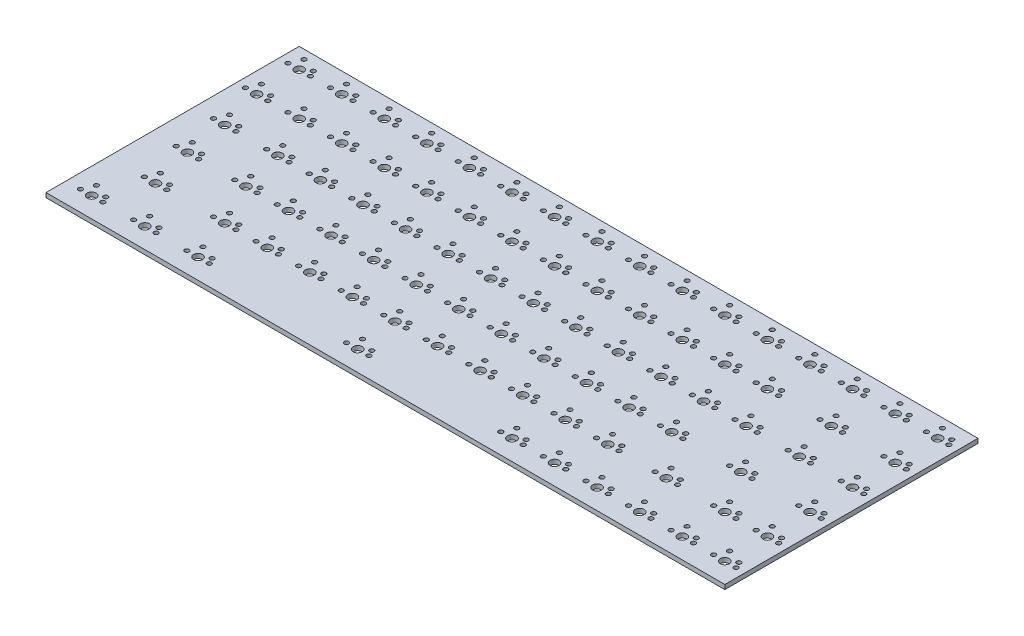
from build123d import *

# Parameters (mm, degrees)
SKETCH_1_W      = 303
SKETCH_1_H      = 113
SKETCH_1_R      = 1
SKETCH_1_R_2    = 2
EXTRUDE_1_DEPTH = 2


with BuildPart() as part:
    # Эскиз1 → Бобышка-Вытянуть1 (new body)
    with BuildSketch(Plane(origin=(0, 0, 0), x_dir=(1, 0, 0), z_dir=(0, 1, 0))):
        with Locations((142.5, -47.5)):
            Rectangle(SKETCH_1_W, SKETCH_1_H)
        with Locations((-2.867586508, 5)):
            Circle(SKETCH_1_R, mode=Mode.SUBTRACT)
        Circle(SKETCH_1_R_2, mode=Mode.SUBTRACT)
        with Locations((-5, 0)):
            Circle(SKETCH_1_R, mode=Mode.SUBTRACT)
        with Locations((5, 0)):
            Circle(SKETCH_1_R, mode=Mode.SUBTRACT)
        with Locations((3.65, 2.6)):
            Circle(SKETCH_1_R, mode=Mode.SUBTRACT)
        with Locations((16.132413492, 5)):
            Circle(SKETCH_1_R, mode=Mode.SUBTRACT)
        with Locations((19, 0)):
            Circle(SKETCH_1_R_2, mode=Mode.SUBTRACT)
        with Locations((14, 0)):
            Circle(SKETCH_1_R, mode=Mode.SUBTRACT)
        with Locations((24, 0)):
            Circle(SKETCH_1_R, mode=Mode.SUBTRACT)
        with Locations((22.65, 2.6)):
            Circle(SKETCH_1_R, mode=Mode.SUBTRACT)
        with Locations((16.132413492, -14)):
            Circle(SKETCH_1_R, mode=Mode.SUBTRACT)
        with Locations((19, -19)):
            Circle(SKETCH_1_R_2, mode=Mode.SUBTRACT)
        with Locations((14, -19)):
            Circle(SKETCH_1_R, mode=Mode.SUBTRACT)
        with Locations((24, -19)):
            Circle(SKETCH_1_R, mode=Mode.SUBTRACT)
        with Locations((22.65, -16.4)):
            Circle(SKETCH_1_R, mode=Mode.SUBTRACT)
        with Locations((-2.867586508, -14)):
            Circle(SKETCH_1_R, mode=Mode.SUBTRACT)
        with Locations((0, -19)):
            Circle(SKETCH_1_R_2, mode=Mode.SUBTRACT)
        with Locations((-5, -19)):
            Circle(SKETCH_1_R, mode=Mode.SUBTRACT)
        with Locations((5, -19)):
            Circle(SKETCH_1_R, mode=Mode.SUBTRACT)
        with Locations((3.65, -16.4)):
            Circle(SKETCH_1_R, mode=Mode.SUBTRACT)
        with Locations((35.132413492, 5)):
            Circle(SKETCH_1_R, mode=Mode.SUBTRACT)
        with Locations((38, 0)):
            Circle(SKETCH_1_R_2, mode=Mode.SUBTRACT)
        with Locations((33, 0)):
            Circle(SKETCH_1_R, mode=Mode.SUBTRACT)
        with Locations((43, 0)):
            Circle(SKETCH_1_R, mode=Mode.SUBTRACT)
        with Locations((41.65, 2.6)):
            Circle(SKETCH_1_R, mode=Mode.SUBTRACT)
        with Locations((35.132413492, -14)):
            Circle(SKETCH_1_R, mode=Mode.SUBTRACT)
        with Locations((38, -19)):
            Circle(SKETCH_1_R_2, mode=Mode.SUBTRACT)
        with Locations((33, -19)):
            Circle(SKETCH_1_R, mode=Mode.SUBTRACT)
        with Locations((43, -19)):
            Circle(SKETCH_1_R, mode=Mode.SUBTRACT)
        with Locations((41.65, -16.4)):
            Circle(SKETCH_1_R, mode=Mode.SUBTRACT)
        with Locations((54.132413492, 5)):
            Circle(SKETCH_1_R, mode=Mode.SUBTRACT)
        with Locations((57, 0)):
            Circle(SKETCH_1_R_2, mode=Mode.SUBTRACT)
        with Locations((52, 0)):
            Circle(SKETCH_1_R, mode=Mode.SUBTRACT)
        with Locations((62, 0)):
            Circle(SKETCH_1_R, mode=Mode.SUBTRACT)
        with Locations((60.65, 2.6)):
            Circle(SKETCH_1_R, mode=Mode.SUBTRACT)
        with Locations((54.132413492, -14)):
            Circle(SKETCH_1_R, mode=Mode.SUBTRACT)
        with Locations((57, -19)):
            Circle(SKETCH_1_R_2, mode=Mode.SUBTRACT)
        with Locations((52, -19)):
            Circle(SKETCH_1_R, mode=Mode.SUBTRACT)
        with Locations((62, -19)):
            Circle(SKETCH_1_R, mode=Mode.SUBTRACT)
        with Locations((60.65, -16.4)):
            Circle(SKETCH_1_R, mode=Mode.SUBTRACT)
        with Locations((73.132413492, 5)):
            Circle(SKETCH_1_R, mode=Mode.SUBTRACT)
        with Locations((76, 0)):
            Circle(SKETCH_1_R_2, mode=Mode.SUBTRACT)
        with Locations((71, 0)):
            Circle(SKETCH_1_R, mode=Mode.SUBTRACT)
        with Locations((81, 0)):
            Circle(SKETCH_1_R, mode=Mode.SUBTRACT)
        with Locations((79.65, 2.6)):
            Circle(SKETCH_1_R, mode=Mode.SUBTRACT)
        with Locations((92.132413492, 5)):
            Circle(SKETCH_1_R, mode=Mode.SUBTRACT)
        with Locations((95, 0)):
            Circle(SKETCH_1_R_2, mode=Mode.SUBTRACT)
        with Locations((90, 0)):
            Circle(SKETCH_1_R, mode=Mode.SUBTRACT)
        with Locations((100, 0)):
            Circle(SKETCH_1_R, mode=Mode.SUBTRACT)
        with Locations((98.65, 2.6)):
            Circle(SKETCH_1_R, mode=Mode.SUBTRACT)
        with Locations((111.132413492, 5)):
            Circle(SKETCH_1_R, mode=Mode.SUBTRACT)
        with Locations((114, 0)):
            Circle(SKETCH_1_R_2, mode=Mode.SUBTRACT)
        with Locations((109, 0)):
            Circle(SKETCH_1_R, mode=Mode.SUBTRACT)
        with Locations((119, 0)):
            Circle(SKETCH_1_R, mode=Mode.SUBTRACT)
        with Locations((117.65, 2.6)):
            Circle(SKETCH_1_R, mode=Mode.SUBTRACT)
        with Locations((130.132413492, 5)):
            Circle(SKETCH_1_R, mode=Mode.SUBTRACT)
        with Locations((133, 0)):
            Circle(SKETCH_1_R_2, mode=Mode.SUBTRACT)
        with Locations((128, 0)):
            Circle(SKETCH_1_R, mode=Mode.SUBTRACT)
        with Locations((138, 0)):
            Circle(SKETCH_1_R, mode=Mode.SUBTRACT)
        with Locations((136.65, 2.6)):
            Circle(SKETCH_1_R, mode=Mode.SUBTRACT)
        with Locations((149.132413492, 5)):
            Circle(SKETCH_1_R, mode=Mode.SUBTRACT)
        with Locations((152, 0)):
            Circle(SKETCH_1_R_2, mode=Mode.SUBTRACT)
        with Locations((147, 0)):
            Circle(SKETCH_1_R, mode=Mode.SUBTRACT)
        with Locations((157, 0)):
            Circle(SKETCH_1_R, mode=Mode.SUBTRACT)
        with Locations((155.65, 2.6)):
            Circle(SKETCH_1_R, mode=Mode.SUBTRACT)
        with Locations((168.132413492, 5)):
            Circle(SKETCH_1_R, mode=Mode.SUBTRACT)
        with Locations((171, 0)):
            Circle(SKETCH_1_R_2, mode=Mode.SUBTRACT)
        with Locations((166, 0)):
            Circle(SKETCH_1_R, mode=Mode.SUBTRACT)
        with Locations((176, 0)):
            Circle(SKETCH_1_R, mode=Mode.SUBTRACT)
        with Locations((174.65, 2.6)):
            Circle(SKETCH_1_R, mode=Mode.SUBTRACT)
        with Locations((187.132413492, 5)):
            Circle(SKETCH_1_R, mode=Mode.SUBTRACT)
        with Locations((190, 0)):
            Circle(SKETCH_1_R_2, mode=Mode.SUBTRACT)
        with Locations((185, 0)):
            Circle(SKETCH_1_R, mode=Mode.SUBTRACT)
        with Locations((195, 0)):
            Circle(SKETCH_1_R, mode=Mode.SUBTRACT)
        with Locations((193.65, 2.6)):
            Circle(SKETCH_1_R, mode=Mode.SUBTRACT)
        with Locations((187.132413492, -14)):
            Circle(SKETCH_1_R, mode=Mode.SUBTRACT)
        with Locations((190, -19)):
            Circle(SKETCH_1_R_2, mode=Mode.SUBTRACT)
        with Locations((185, -19)):
            Circle(SKETCH_1_R, mode=Mode.SUBTRACT)
        with Locations((195, -19)):
            Circle(SKETCH_1_R, mode=Mode.SUBTRACT)
        with Locations((193.65, -16.4)):
            Circle(SKETCH_1_R, mode=Mode.SUBTRACT)
        with Locations((168.132413492, -14)):
            Circle(SKETCH_1_R, mode=Mode.SUBTRACT)
        with Locations((171, -19)):
            Circle(SKETCH_1_R_2, mode=Mode.SUBTRACT)
        with Locations((166, -19)):
            Circle(SKETCH_1_R, mode=Mode.SUBTRACT)
        with Locations((176, -19)):
            Circle(SKETCH_1_R, mode=Mode.SUBTRACT)
        with Locations((174.65, -16.4)):
            Circle(SKETCH_1_R, mode=Mode.SUBTRACT)
        with Locations((149.132413492, -14)):
            Circle(SKETCH_1_R, mode=Mode.SUBTRACT)
        with Locations((152, -19)):
            Circle(SKETCH_1_R_2, mode=Mode.SUBTRACT)
        with Locations((147, -19)):
            Circle(SKETCH_1_R, mode=Mode.SUBTRACT)
        with Locations((157, -19)):
            Circle(SKETCH_1_R, mode=Mode.SUBTRACT)
        with Locations((155.65, -16.4)):
            Circle(SKETCH_1_R, mode=Mode.SUBTRACT)
        with Locations((130.132413492, -14)):
            Circle(SKETCH_1_R, mode=Mode.SUBTRACT)
        with Locations((133, -19)):
            Circle(SKETCH_1_R_2, mode=Mode.SUBTRACT)
        with Locations((128, -19)):
            Circle(SKETCH_1_R, mode=Mode.SUBTRACT)
        with Locations((138, -19)):
            Circle(SKETCH_1_R, mode=Mode.SUBTRACT)
        with Locations((136.65, -16.4)):
            Circle(SKETCH_1_R, mode=Mode.SUBTRACT)
        with Locations((111.132413492, -14)):
            Circle(SKETCH_1_R, mode=Mode.SUBTRACT)
        with Locations((114, -19)):
            Circle(SKETCH_1_R_2, mode=Mode.SUBTRACT)
        with Locations((109, -19)):
            Circle(SKETCH_1_R, mode=Mode.SUBTRACT)
        with Locations((119, -19)):
            Circle(SKETCH_1_R, mode=Mode.SUBTRACT)
        with Locations((117.65, -16.4)):
            Circle(SKETCH_1_R, mode=Mode.SUBTRACT)
        with Locations((92.132413492, -14)):
            Circle(SKETCH_1_R, mode=Mode.SUBTRACT)
        with Locations((95, -19)):
            Circle(SKETCH_1_R_2, mode=Mode.SUBTRACT)
        with Locations((90, -19)):
            Circle(SKETCH_1_R, mode=Mode.SUBTRACT)
        with Locations((100, -19)):
            Circle(SKETCH_1_R, mode=Mode.SUBTRACT)
        with Locations((98.65, -16.4)):
            Circle(SKETCH_1_R, mode=Mode.SUBTRACT)
        with Locations((73.132413492, -14)):
            Circle(SKETCH_1_R, mode=Mode.SUBTRACT)
        with Locations((76, -19)):
            Circle(SKETCH_1_R_2, mode=Mode.SUBTRACT)
        with Locations((71, -19)):
            Circle(SKETCH_1_R, mode=Mode.SUBTRACT)
        with Locations((81, -19)):
            Circle(SKETCH_1_R, mode=Mode.SUBTRACT)
        with Locations((79.65, -16.4)):
            Circle(SKETCH_1_R, mode=Mode.SUBTRACT)
        with Locations((196.632413492, -33)):
            Circle(SKETCH_1_R, mode=Mode.SUBTRACT)
        with Locations((199.5, -38)):
            Circle(SKETCH_1_R_2, mode=Mode.SUBTRACT)
        with Locations((194.5, -38)):
            Circle(SKETCH_1_R, mode=Mode.SUBTRACT)
        with Locations((204.5, -38)):
            Circle(SKETCH_1_R, mode=Mode.SUBTRACT)
        with Locations((203.15, -35.4)):
            Circle(SKETCH_1_R, mode=Mode.SUBTRACT)
        with Locations((177.632413492, -33)):
            Circle(SKETCH_1_R, mode=Mode.SUBTRACT)
        with Locations((180.5, -38)):
            Circle(SKETCH_1_R_2, mode=Mode.SUBTRACT)
        with Locations((175.5, -38)):
            Circle(SKETCH_1_R, mode=Mode.SUBTRACT)
        with Locations((185.5, -38)):
            Circle(SKETCH_1_R, mode=Mode.SUBTRACT)
        with Locations((184.15, -35.4)):
            Circle(SKETCH_1_R, mode=Mode.SUBTRACT)
        with Locations((158.632413492, -33)):
            Circle(SKETCH_1_R, mode=Mode.SUBTRACT)
        with Locations((161.5, -38)):
            Circle(SKETCH_1_R_2, mode=Mode.SUBTRACT)
        with Locations((156.5, -38)):
            Circle(SKETCH_1_R, mode=Mode.SUBTRACT)
        with Locations((166.5, -38)):
            Circle(SKETCH_1_R, mode=Mode.SUBTRACT)
        with Locations((165.15, -35.4)):
            Circle(SKETCH_1_R, mode=Mode.SUBTRACT)
        with Locations((139.632413492, -33)):
            Circle(SKETCH_1_R, mode=Mode.SUBTRACT)
        with Locations((142.5, -38)):
            Circle(SKETCH_1_R_2, mode=Mode.SUBTRACT)
        with Locations((137.5, -38)):
            Circle(SKETCH_1_R, mode=Mode.SUBTRACT)
        with Locations((147.5, -38)):
            Circle(SKETCH_1_R, mode=Mode.SUBTRACT)
        with Locations((146.15, -35.4)):
            Circle(SKETCH_1_R, mode=Mode.SUBTRACT)
        with Locations((120.632413492, -33)):
            Circle(SKETCH_1_R, mode=Mode.SUBTRACT)
        with Locations((123.5, -38)):
            Circle(SKETCH_1_R_2, mode=Mode.SUBTRACT)
        with Locations((118.5, -38)):
            Circle(SKETCH_1_R, mode=Mode.SUBTRACT)
        with Locations((128.5, -38)):
            Circle(SKETCH_1_R, mode=Mode.SUBTRACT)
        with Locations((127.15, -35.4)):
            Circle(SKETCH_1_R, mode=Mode.SUBTRACT)
        with Locations((101.632413492, -33)):
            Circle(SKETCH_1_R, mode=Mode.SUBTRACT)
        with Locations((104.5, -38)):
            Circle(SKETCH_1_R_2, mode=Mode.SUBTRACT)
        with Locations((99.5, -38)):
            Circle(SKETCH_1_R, mode=Mode.SUBTRACT)
        with Locations((109.5, -38)):
            Circle(SKETCH_1_R, mode=Mode.SUBTRACT)
        with Locations((108.15, -35.4)):
            Circle(SKETCH_1_R, mode=Mode.SUBTRACT)
        with Locations((82.632413492, -33)):
            Circle(SKETCH_1_R, mode=Mode.SUBTRACT)
        with Locations((85.5, -38)):
            Circle(SKETCH_1_R_2, mode=Mode.SUBTRACT)
        with Locations((80.5, -38)):
            Circle(SKETCH_1_R, mode=Mode.SUBTRACT)
        with Locations((90.5, -38)):
            Circle(SKETCH_1_R, mode=Mode.SUBTRACT)
        with Locations((89.15, -35.4)):
            Circle(SKETCH_1_R, mode=Mode.SUBTRACT)
        with Locations((63.632413492, -33)):
            Circle(SKETCH_1_R, mode=Mode.SUBTRACT)
        with Locations((66.5, -38)):
            Circle(SKETCH_1_R_2, mode=Mode.SUBTRACT)
        with Locations((61.5, -38)):
            Circle(SKETCH_1_R, mode=Mode.SUBTRACT)
        with Locations((71.5, -38)):
            Circle(SKETCH_1_R, mode=Mode.SUBTRACT)
        with Locations((70.15, -35.4)):
            Circle(SKETCH_1_R, mode=Mode.SUBTRACT)
        with Locations((44.632413492, -33)):
            Circle(SKETCH_1_R, mode=Mode.SUBTRACT)
        with Locations((47.5, -38)):
            Circle(SKETCH_1_R_2, mode=Mode.SUBTRACT)
        with Locations((42.5, -38)):
            Circle(SKETCH_1_R, mode=Mode.SUBTRACT)
        with Locations((52.5, -38)):
            Circle(SKETCH_1_R, mode=Mode.SUBTRACT)
        with Locations((51.15, -35.4)):
            Circle(SKETCH_1_R, mode=Mode.SUBTRACT)
        with Locations((25.632413492, -33)):
            Circle(SKETCH_1_R, mode=Mode.SUBTRACT)
        with Locations((28.5, -38)):
            Circle(SKETCH_1_R_2, mode=Mode.SUBTRACT)
        with Locations((23.5, -38)):
            Circle(SKETCH_1_R, mode=Mode.SUBTRACT)
        with Locations((33.5, -38)):
            Circle(SKETCH_1_R, mode=Mode.SUBTRACT)
        with Locations((32.15, -35.4)):
            Circle(SKETCH_1_R, mode=Mode.SUBTRACT)
        with Locations((1.882413492, -33)):
            Circle(SKETCH_1_R, mode=Mode.SUBTRACT)
        with Locations((4.75, -38)):
            Circle(SKETCH_1_R_2, mode=Mode.SUBTRACT)
        with Locations((-0.25, -38)):
            Circle(SKETCH_1_R, mode=Mode.SUBTRACT)
        with Locations((9.75, -38)):
            Circle(SKETCH_1_R, mode=Mode.SUBTRACT)
        with Locations((8.4, -35.4)):
            Circle(SKETCH_1_R, mode=Mode.SUBTRACT)
        with Locations((4.257413492, -52)):
            Circle(SKETCH_1_R, mode=Mode.SUBTRACT)
        with Locations((7.125, -57)):
            Circle(SKETCH_1_R_2, mode=Mode.SUBTRACT)
        with Locations((2.125, -57)):
            Circle(SKETCH_1_R, mode=Mode.SUBTRACT)
        with Locations((12.125, -57)):
            Circle(SKETCH_1_R, mode=Mode.SUBTRACT)
        with Locations((10.775, -54.4)):
            Circle(SKETCH_1_R, mode=Mode.SUBTRACT)
        with Locations((30.382413492, -52)):
            Circle(SKETCH_1_R, mode=Mode.SUBTRACT)
        with Locations((33.25, -57)):
            Circle(SKETCH_1_R_2, mode=Mode.SUBTRACT)
        with Locations((28.25, -57)):
            Circle(SKETCH_1_R, mode=Mode.SUBTRACT)
        with Locations((38.25, -57)):
            Circle(SKETCH_1_R, mode=Mode.SUBTRACT)
        with Locations((36.9, -54.4)):
            Circle(SKETCH_1_R, mode=Mode.SUBTRACT)
        with Locations((49.382413492, -52)):
            Circle(SKETCH_1_R, mode=Mode.SUBTRACT)
        with Locations((52.25, -57)):
            Circle(SKETCH_1_R_2, mode=Mode.SUBTRACT)
        with Locations((47.25, -57)):
            Circle(SKETCH_1_R, mode=Mode.SUBTRACT)
        with Locations((57.25, -57)):
            Circle(SKETCH_1_R, mode=Mode.SUBTRACT)
        with Locations((55.9, -54.4)):
            Circle(SKETCH_1_R, mode=Mode.SUBTRACT)
        with Locations((68.382413492, -52)):
            Circle(SKETCH_1_R, mode=Mode.SUBTRACT)
        with Locations((71.25, -57)):
            Circle(SKETCH_1_R_2, mode=Mode.SUBTRACT)
        with Locations((66.25, -57)):
            Circle(SKETCH_1_R, mode=Mode.SUBTRACT)
        with Locations((76.25, -57)):
            Circle(SKETCH_1_R, mode=Mode.SUBTRACT)
        with Locations((74.9, -54.4)):
            Circle(SKETCH_1_R, mode=Mode.SUBTRACT)
        with Locations((87.382413492, -52)):
            Circle(SKETCH_1_R, mode=Mode.SUBTRACT)
        with Locations((90.25, -57)):
            Circle(SKETCH_1_R_2, mode=Mode.SUBTRACT)
        with Locations((85.25, -57)):
            Circle(SKETCH_1_R, mode=Mode.SUBTRACT)
        with Locations((95.25, -57)):
            Circle(SKETCH_1_R, mode=Mode.SUBTRACT)
        with Locations((93.9, -54.4)):
            Circle(SKETCH_1_R, mode=Mode.SUBTRACT)
        with Locations((106.382413492, -52)):
            Circle(SKETCH_1_R, mode=Mode.SUBTRACT)
        with Locations((109.25, -57)):
            Circle(SKETCH_1_R_2, mode=Mode.SUBTRACT)
        with Locations((104.25, -57)):
            Circle(SKETCH_1_R, mode=Mode.SUBTRACT)
        with Locations((114.25, -57)):
            Circle(SKETCH_1_R, mode=Mode.SUBTRACT)
        with Locations((112.9, -54.4)):
            Circle(SKETCH_1_R, mode=Mode.SUBTRACT)
        with Locations((125.382413492, -52)):
            Circle(SKETCH_1_R, mode=Mode.SUBTRACT)
        with Locations((128.25, -57)):
            Circle(SKETCH_1_R_2, mode=Mode.SUBTRACT)
        with Locations((123.25, -57)):
            Circle(SKETCH_1_R, mode=Mode.SUBTRACT)
        with Locations((133.25, -57)):
            Circle(SKETCH_1_R, mode=Mode.SUBTRACT)
        with Locations((131.9, -54.4)):
            Circle(SKETCH_1_R, mode=Mode.SUBTRACT)
        with Locations((144.382413492, -52)):
            Circle(SKETCH_1_R, mode=Mode.SUBTRACT)
        with Locations((147.25, -57)):
            Circle(SKETCH_1_R_2, mode=Mode.SUBTRACT)
        with Locations((142.25, -57)):
            Circle(SKETCH_1_R, mode=Mode.SUBTRACT)
        with Locations((152.25, -57)):
            Circle(SKETCH_1_R, mode=Mode.SUBTRACT)
        with Locations((150.9, -54.4)):
            Circle(SKETCH_1_R, mode=Mode.SUBTRACT)
        with Locations((163.382413492, -52)):
            Circle(SKETCH_1_R, mode=Mode.SUBTRACT)
        with Locations((166.25, -57)):
            Circle(SKETCH_1_R_2, mode=Mode.SUBTRACT)
        with Locations((161.25, -57)):
            Circle(SKETCH_1_R, mode=Mode.SUBTRACT)
        with Locations((171.25, -57)):
            Circle(SKETCH_1_R, mode=Mode.SUBTRACT)
        with Locations((169.9, -54.4)):
            Circle(SKETCH_1_R, mode=Mode.SUBTRACT)
        with Locations((182.382413492, -52)):
            Circle(SKETCH_1_R, mode=Mode.SUBTRACT)
        with Locations((185.25, -57)):
            Circle(SKETCH_1_R_2, mode=Mode.SUBTRACT)
        with Locations((180.25, -57)):
            Circle(SKETCH_1_R, mode=Mode.SUBTRACT)
        with Locations((190.25, -57)):
            Circle(SKETCH_1_R, mode=Mode.SUBTRACT)
        with Locations((188.9, -54.4)):
            Circle(SKETCH_1_R, mode=Mode.SUBTRACT)
        with Locations((201.382413492, -52)):
            Circle(SKETCH_1_R, mode=Mode.SUBTRACT)
        with Locations((204.25, -57)):
            Circle(SKETCH_1_R_2, mode=Mode.SUBTRACT)
        with Locations((199.25, -57)):
            Circle(SKETCH_1_R, mode=Mode.SUBTRACT)
        with Locations((209.25, -57)):
            Circle(SKETCH_1_R, mode=Mode.SUBTRACT)
        with Locations((207.9, -54.4)):
            Circle(SKETCH_1_R, mode=Mode.SUBTRACT)
        with Locations((191.882413492, -71)):
            Circle(SKETCH_1_R, mode=Mode.SUBTRACT)
        with Locations((194.75, -76)):
            Circle(SKETCH_1_R_2, mode=Mode.SUBTRACT)
        with Locations((189.75, -76)):
            Circle(SKETCH_1_R, mode=Mode.SUBTRACT)
        with Locations((199.75, -76)):
            Circle(SKETCH_1_R, mode=Mode.SUBTRACT)
        with Locations((198.4, -73.4)):
            Circle(SKETCH_1_R, mode=Mode.SUBTRACT)
        with Locations((172.882413492, -71)):
            Circle(SKETCH_1_R, mode=Mode.SUBTRACT)
        with Locations((175.75, -76)):
            Circle(SKETCH_1_R_2, mode=Mode.SUBTRACT)
        with Locations((170.75, -76)):
            Circle(SKETCH_1_R, mode=Mode.SUBTRACT)
        with Locations((180.75, -76)):
            Circle(SKETCH_1_R, mode=Mode.SUBTRACT)
        with Locations((179.4, -73.4)):
            Circle(SKETCH_1_R, mode=Mode.SUBTRACT)
        with Locations((153.882413492, -71)):
            Circle(SKETCH_1_R, mode=Mode.SUBTRACT)
        with Locations((156.75, -76)):
            Circle(SKETCH_1_R_2, mode=Mode.SUBTRACT)
        with Locations((151.75, -76)):
            Circle(SKETCH_1_R, mode=Mode.SUBTRACT)
        with Locations((161.75, -76)):
            Circle(SKETCH_1_R, mode=Mode.SUBTRACT)
        with Locations((160.4, -73.4)):
            Circle(SKETCH_1_R, mode=Mode.SUBTRACT)
        with Locations((134.882413492, -71)):
            Circle(SKETCH_1_R, mode=Mode.SUBTRACT)
        with Locations((137.75, -76)):
            Circle(SKETCH_1_R_2, mode=Mode.SUBTRACT)
        with Locations((132.75, -76)):
            Circle(SKETCH_1_R, mode=Mode.SUBTRACT)
        with Locations((142.75, -76)):
            Circle(SKETCH_1_R, mode=Mode.SUBTRACT)
        with Locations((141.4, -73.4)):
            Circle(SKETCH_1_R, mode=Mode.SUBTRACT)
        with Locations((115.882413492, -71)):
            Circle(SKETCH_1_R, mode=Mode.SUBTRACT)
        with Locations((118.75, -76)):
            Circle(SKETCH_1_R_2, mode=Mode.SUBTRACT)
        with Locations((113.75, -76)):
            Circle(SKETCH_1_R, mode=Mode.SUBTRACT)
        with Locations((123.75, -76)):
            Circle(SKETCH_1_R, mode=Mode.SUBTRACT)
        with Locations((122.4, -73.4)):
            Circle(SKETCH_1_R, mode=Mode.SUBTRACT)
        with Locations((96.882413492, -71)):
            Circle(SKETCH_1_R, mode=Mode.SUBTRACT)
        with Locations((99.75, -76)):
            Circle(SKETCH_1_R_2, mode=Mode.SUBTRACT)
        with Locations((94.75, -76)):
            Circle(SKETCH_1_R, mode=Mode.SUBTRACT)
        with Locations((104.75, -76)):
            Circle(SKETCH_1_R, mode=Mode.SUBTRACT)
        with Locations((103.4, -73.4)):
            Circle(SKETCH_1_R, mode=Mode.SUBTRACT)
        with Locations((77.882413492, -71)):
            Circle(SKETCH_1_R, mode=Mode.SUBTRACT)
        with Locations((80.75, -76)):
            Circle(SKETCH_1_R_2, mode=Mode.SUBTRACT)
        with Locations((75.75, -76)):
            Circle(SKETCH_1_R, mode=Mode.SUBTRACT)
        with Locations((85.75, -76)):
            Circle(SKETCH_1_R, mode=Mode.SUBTRACT)
        with Locations((84.4, -73.4)):
            Circle(SKETCH_1_R, mode=Mode.SUBTRACT)
        with Locations((58.882413492, -71)):
            Circle(SKETCH_1_R, mode=Mode.SUBTRACT)
        with Locations((61.75, -76)):
            Circle(SKETCH_1_R_2, mode=Mode.SUBTRACT)
        with Locations((56.75, -76)):
            Circle(SKETCH_1_R, mode=Mode.SUBTRACT)
        with Locations((66.75, -76)):
            Circle(SKETCH_1_R, mode=Mode.SUBTRACT)
        with Locations((65.4, -73.4)):
            Circle(SKETCH_1_R, mode=Mode.SUBTRACT)
        with Locations((39.882413492, -71)):
            Circle(SKETCH_1_R, mode=Mode.SUBTRACT)
        with Locations((42.75, -76)):
            Circle(SKETCH_1_R_2, mode=Mode.SUBTRACT)
        with Locations((37.75, -76)):
            Circle(SKETCH_1_R, mode=Mode.SUBTRACT)
        with Locations((47.75, -76)):
            Circle(SKETCH_1_R, mode=Mode.SUBTRACT)
        with Locations((46.4, -73.4)):
            Circle(SKETCH_1_R, mode=Mode.SUBTRACT)
        with Locations((9.007413492, -71)):
            Circle(SKETCH_1_R, mode=Mode.SUBTRACT)
        with Locations((11.875, -76)):
            Circle(SKETCH_1_R_2, mode=Mode.SUBTRACT)
        with Locations((6.875, -76)):
            Circle(SKETCH_1_R, mode=Mode.SUBTRACT)
        with Locations((16.875, -76)):
            Circle(SKETCH_1_R, mode=Mode.SUBTRACT)
        with Locations((15.525, -73.4)):
            Circle(SKETCH_1_R, mode=Mode.SUBTRACT)
        with Locations((206.132413492, 5)):
            Circle(SKETCH_1_R, mode=Mode.SUBTRACT)
        with Locations((209, 0)):
            Circle(SKETCH_1_R_2, mode=Mode.SUBTRACT)
        with Locations((204, 0)):
            Circle(SKETCH_1_R, mode=Mode.SUBTRACT)
        with Locations((214, 0)):
            Circle(SKETCH_1_R, mode=Mode.SUBTRACT)
        with Locations((212.65, 2.6)):
            Circle(SKETCH_1_R, mode=Mode.SUBTRACT)
        with Locations((225.132413492, 5)):
            Circle(SKETCH_1_R, mode=Mode.SUBTRACT)
        with Locations((228, 0)):
            Circle(SKETCH_1_R_2, mode=Mode.SUBTRACT)
        with Locations((223, 0)):
            Circle(SKETCH_1_R, mode=Mode.SUBTRACT)
        with Locations((233, 0)):
            Circle(SKETCH_1_R, mode=Mode.SUBTRACT)
        with Locations((231.65, 2.6)):
            Circle(SKETCH_1_R, mode=Mode.SUBTRACT)
        with Locations((244.132413492, 5)):
            Circle(SKETCH_1_R, mode=Mode.SUBTRACT)
        with Locations((247, 0)):
            Circle(SKETCH_1_R_2, mode=Mode.SUBTRACT)
        with Locations((242, 0)):
            Circle(SKETCH_1_R, mode=Mode.SUBTRACT)
        with Locations((252, 0)):
            Circle(SKETCH_1_R, mode=Mode.SUBTRACT)
        with Locations((250.65, 2.6)):
            Circle(SKETCH_1_R, mode=Mode.SUBTRACT)
        with Locations((263.132413492, 5)):
            Circle(SKETCH_1_R, mode=Mode.SUBTRACT)
        with Locations((266, 0)):
            Circle(SKETCH_1_R_2, mode=Mode.SUBTRACT)
        with Locations((261, 0)):
            Circle(SKETCH_1_R, mode=Mode.SUBTRACT)
        with Locations((271, 0)):
            Circle(SKETCH_1_R, mode=Mode.SUBTRACT)
        with Locations((269.65, 2.6)):
            Circle(SKETCH_1_R, mode=Mode.SUBTRACT)
        with Locations((282.132413492, 5)):
            Circle(SKETCH_1_R, mode=Mode.SUBTRACT)
        with Locations((285, 0)):
            Circle(SKETCH_1_R_2, mode=Mode.SUBTRACT)
        with Locations((280, 0)):
            Circle(SKETCH_1_R, mode=Mode.SUBTRACT)
        with Locations((290, 0)):
            Circle(SKETCH_1_R, mode=Mode.SUBTRACT)
        with Locations((288.65, 2.6)):
            Circle(SKETCH_1_R, mode=Mode.SUBTRACT)
        with Locations((282.132413492, -14)):
            Circle(SKETCH_1_R, mode=Mode.SUBTRACT)
        with Locations((285, -19)):
            Circle(SKETCH_1_R_2, mode=Mode.SUBTRACT)
        with Locations((280, -19)):
            Circle(SKETCH_1_R, mode=Mode.SUBTRACT)
        with Locations((290, -19)):
            Circle(SKETCH_1_R, mode=Mode.SUBTRACT)
        with Locations((288.65, -16.4)):
            Circle(SKETCH_1_R, mode=Mode.SUBTRACT)
        with Locations((253.632413492, -14)):
            Circle(SKETCH_1_R, mode=Mode.SUBTRACT)
        with Locations((256.5, -19)):
            Circle(SKETCH_1_R_2, mode=Mode.SUBTRACT)
        with Locations((251.5, -19)):
            Circle(SKETCH_1_R, mode=Mode.SUBTRACT)
        with Locations((261.5, -19)):
            Circle(SKETCH_1_R, mode=Mode.SUBTRACT)
        with Locations((260.15, -16.4)):
            Circle(SKETCH_1_R, mode=Mode.SUBTRACT)
        with Locations((225.132413492, -14)):
            Circle(SKETCH_1_R, mode=Mode.SUBTRACT)
        with Locations((228, -19)):
            Circle(SKETCH_1_R_2, mode=Mode.SUBTRACT)
        with Locations((223, -19)):
            Circle(SKETCH_1_R, mode=Mode.SUBTRACT)
        with Locations((233, -19)):
            Circle(SKETCH_1_R, mode=Mode.SUBTRACT)
        with Locations((231.65, -16.4)):
            Circle(SKETCH_1_R, mode=Mode.SUBTRACT)
        with Locations((206.132413492, -14)):
            Circle(SKETCH_1_R, mode=Mode.SUBTRACT)
        with Locations((209, -19)):
            Circle(SKETCH_1_R_2, mode=Mode.SUBTRACT)
        with Locations((204, -19)):
            Circle(SKETCH_1_R, mode=Mode.SUBTRACT)
        with Locations((214, -19)):
            Circle(SKETCH_1_R, mode=Mode.SUBTRACT)
        with Locations((212.65, -16.4)):
            Circle(SKETCH_1_R, mode=Mode.SUBTRACT)
        with Locations((215.632413492, -33)):
            Circle(SKETCH_1_R, mode=Mode.SUBTRACT)
        with Locations((218.5, -38)):
            Circle(SKETCH_1_R_2, mode=Mode.SUBTRACT)
        with Locations((213.5, -38)):
            Circle(SKETCH_1_R, mode=Mode.SUBTRACT)
        with Locations((223.5, -38)):
            Circle(SKETCH_1_R, mode=Mode.SUBTRACT)
        with Locations((222.15, -35.4)):
            Circle(SKETCH_1_R, mode=Mode.SUBTRACT)
        with Locations((234.632413492, -33)):
            Circle(SKETCH_1_R, mode=Mode.SUBTRACT)
        with Locations((237.5, -38)):
            Circle(SKETCH_1_R_2, mode=Mode.SUBTRACT)
        with Locations((232.5, -38)):
            Circle(SKETCH_1_R, mode=Mode.SUBTRACT)
        with Locations((242.5, -38)):
            Circle(SKETCH_1_R, mode=Mode.SUBTRACT)
        with Locations((241.15, -35.4)):
            Circle(SKETCH_1_R, mode=Mode.SUBTRACT)
        with Locations((258.382413492, -33)):
            Circle(SKETCH_1_R, mode=Mode.SUBTRACT)
        with Locations((261.25, -38)):
            Circle(SKETCH_1_R_2, mode=Mode.SUBTRACT)
        with Locations((256.25, -38)):
            Circle(SKETCH_1_R, mode=Mode.SUBTRACT)
        with Locations((266.25, -38)):
            Circle(SKETCH_1_R, mode=Mode.SUBTRACT)
        with Locations((264.9, -35.4)):
            Circle(SKETCH_1_R, mode=Mode.SUBTRACT)
        with Locations((282.132413492, -33)):
            Circle(SKETCH_1_R, mode=Mode.SUBTRACT)
        with Locations((285, -38)):
            Circle(SKETCH_1_R_2, mode=Mode.SUBTRACT)
        with Locations((280, -38)):
            Circle(SKETCH_1_R, mode=Mode.SUBTRACT)
        with Locations((290, -38)):
            Circle(SKETCH_1_R, mode=Mode.SUBTRACT)
        with Locations((288.65, -35.4)):
            Circle(SKETCH_1_R, mode=Mode.SUBTRACT)
        with Locations((282.132413492, -52)):
            Circle(SKETCH_1_R, mode=Mode.SUBTRACT)
        with Locations((285, -57)):
            Circle(SKETCH_1_R_2, mode=Mode.SUBTRACT)
        with Locations((280, -57)):
            Circle(SKETCH_1_R, mode=Mode.SUBTRACT)
        with Locations((290, -57)):
            Circle(SKETCH_1_R, mode=Mode.SUBTRACT)
        with Locations((288.65, -54.4)):
            Circle(SKETCH_1_R, mode=Mode.SUBTRACT)
        with Locations((251.257413492, -52)):
            Circle(SKETCH_1_R, mode=Mode.SUBTRACT)
        with Locations((254.125, -57)):
            Circle(SKETCH_1_R_2, mode=Mode.SUBTRACT)
        with Locations((249.125, -57)):
            Circle(SKETCH_1_R, mode=Mode.SUBTRACT)
        with Locations((259.125, -57)):
            Circle(SKETCH_1_R, mode=Mode.SUBTRACT)
        with Locations((257.775, -54.4)):
            Circle(SKETCH_1_R, mode=Mode.SUBTRACT)
        with Locations((220.382413492, -52)):
            Circle(SKETCH_1_R, mode=Mode.SUBTRACT)
        with Locations((223.25, -57)):
            Circle(SKETCH_1_R_2, mode=Mode.SUBTRACT)
        with Locations((218.25, -57)):
            Circle(SKETCH_1_R, mode=Mode.SUBTRACT)
        with Locations((228.25, -57)):
            Circle(SKETCH_1_R, mode=Mode.SUBTRACT)
        with Locations((226.9, -54.4)):
            Circle(SKETCH_1_R, mode=Mode.SUBTRACT)
        with Locations((210.882413492, -71)):
            Circle(SKETCH_1_R, mode=Mode.SUBTRACT)
        with Locations((213.75, -76)):
            Circle(SKETCH_1_R_2, mode=Mode.SUBTRACT)
        with Locations((208.75, -76)):
            Circle(SKETCH_1_R, mode=Mode.SUBTRACT)
        with Locations((218.75, -76)):
            Circle(SKETCH_1_R, mode=Mode.SUBTRACT)
        with Locations((217.4, -73.4)):
            Circle(SKETCH_1_R, mode=Mode.SUBTRACT)
        with Locations((237.007413492, -71)):
            Circle(SKETCH_1_R, mode=Mode.SUBTRACT)
        with Locations((239.875, -76)):
            Circle(SKETCH_1_R_2, mode=Mode.SUBTRACT)
        with Locations((234.875, -76)):
            Circle(SKETCH_1_R, mode=Mode.SUBTRACT)
        with Locations((244.875, -76)):
            Circle(SKETCH_1_R, mode=Mode.SUBTRACT)
        with Locations((243.525, -73.4)):
            Circle(SKETCH_1_R, mode=Mode.SUBTRACT)
        with Locations((263.132413492, -71)):
            Circle(SKETCH_1_R, mode=Mode.SUBTRACT)
        with Locations((266, -76)):
            Circle(SKETCH_1_R_2, mode=Mode.SUBTRACT)
        with Locations((261, -76)):
            Circle(SKETCH_1_R, mode=Mode.SUBTRACT)
        with Locations((271, -76)):
            Circle(SKETCH_1_R, mode=Mode.SUBTRACT)
        with Locations((269.65, -73.4)):
            Circle(SKETCH_1_R, mode=Mode.SUBTRACT)
        with Locations((282.132413492, -71)):
            Circle(SKETCH_1_R, mode=Mode.SUBTRACT)
        with Locations((285, -76)):
            Circle(SKETCH_1_R_2, mode=Mode.SUBTRACT)
        with Locations((280, -76)):
            Circle(SKETCH_1_R, mode=Mode.SUBTRACT)
        with Locations((290, -76)):
            Circle(SKETCH_1_R, mode=Mode.SUBTRACT)
        with Locations((288.65, -73.4)):
            Circle(SKETCH_1_R, mode=Mode.SUBTRACT)
        with Locations((282.132413492, -90)):
            Circle(SKETCH_1_R, mode=Mode.SUBTRACT)
        with Locations((285, -95)):
            Circle(SKETCH_1_R_2, mode=Mode.SUBTRACT)
        with Locations((280, -95)):
            Circle(SKETCH_1_R, mode=Mode.SUBTRACT)
        with Locations((290, -95)):
            Circle(SKETCH_1_R, mode=Mode.SUBTRACT)
        with Locations((288.65, -92.4)):
            Circle(SKETCH_1_R, mode=Mode.SUBTRACT)
        with Locations((263.132413492, -90)):
            Circle(SKETCH_1_R, mode=Mode.SUBTRACT)
        with Locations((266, -95)):
            Circle(SKETCH_1_R_2, mode=Mode.SUBTRACT)
        with Locations((261, -95)):
            Circle(SKETCH_1_R, mode=Mode.SUBTRACT)
        with Locations((271, -95)):
            Circle(SKETCH_1_R, mode=Mode.SUBTRACT)
        with Locations((269.65, -92.4)):
            Circle(SKETCH_1_R, mode=Mode.SUBTRACT)
        with Locations((244.132413492, -90)):
            Circle(SKETCH_1_R, mode=Mode.SUBTRACT)
        with Locations((247, -95)):
            Circle(SKETCH_1_R_2, mode=Mode.SUBTRACT)
        with Locations((242, -95)):
            Circle(SKETCH_1_R, mode=Mode.SUBTRACT)
        with Locations((252, -95)):
            Circle(SKETCH_1_R, mode=Mode.SUBTRACT)
        with Locations((250.65, -92.4)):
            Circle(SKETCH_1_R, mode=Mode.SUBTRACT)
        with Locations((225.132413492, -90)):
            Circle(SKETCH_1_R, mode=Mode.SUBTRACT)
        with Locations((228, -95)):
            Circle(SKETCH_1_R_2, mode=Mode.SUBTRACT)
        with Locations((223, -95)):
            Circle(SKETCH_1_R, mode=Mode.SUBTRACT)
        with Locations((233, -95)):
            Circle(SKETCH_1_R, mode=Mode.SUBTRACT)
        with Locations((231.65, -92.4)):
            Circle(SKETCH_1_R, mode=Mode.SUBTRACT)
        with Locations((206.132413492, -90)):
            Circle(SKETCH_1_R, mode=Mode.SUBTRACT)
        with Locations((209, -95)):
            Circle(SKETCH_1_R_2, mode=Mode.SUBTRACT)
        with Locations((204, -95)):
            Circle(SKETCH_1_R, mode=Mode.SUBTRACT)
        with Locations((214, -95)):
            Circle(SKETCH_1_R, mode=Mode.SUBTRACT)
        with Locations((212.65, -92.4)):
            Circle(SKETCH_1_R, mode=Mode.SUBTRACT)
        with Locations((187.132413492, -90)):
            Circle(SKETCH_1_R, mode=Mode.SUBTRACT)
        with Locations((190, -95)):
            Circle(SKETCH_1_R_2, mode=Mode.SUBTRACT)
        with Locations((185, -95)):
            Circle(SKETCH_1_R, mode=Mode.SUBTRACT)
        with Locations((195, -95)):
            Circle(SKETCH_1_R, mode=Mode.SUBTRACT)
        with Locations((193.65, -92.4)):
            Circle(SKETCH_1_R, mode=Mode.SUBTRACT)
        with Locations((47.007413492, -90)):
            Circle(SKETCH_1_R, mode=Mode.SUBTRACT)
        with Locations((49.875, -95)):
            Circle(SKETCH_1_R_2, mode=Mode.SUBTRACT)
        with Locations((44.875, -95)):
            Circle(SKETCH_1_R, mode=Mode.SUBTRACT)
        with Locations((54.875, -95)):
            Circle(SKETCH_1_R, mode=Mode.SUBTRACT)
        with Locations((53.525, -92.4)):
            Circle(SKETCH_1_R, mode=Mode.SUBTRACT)
        with Locations((23.257413492, -90)):
            Circle(SKETCH_1_R, mode=Mode.SUBTRACT)
        with Locations((26.125, -95)):
            Circle(SKETCH_1_R_2, mode=Mode.SUBTRACT)
        with Locations((21.125, -95)):
            Circle(SKETCH_1_R, mode=Mode.SUBTRACT)
        with Locations((31.125, -95)):
            Circle(SKETCH_1_R, mode=Mode.SUBTRACT)
        with Locations((29.775, -92.4)):
            Circle(SKETCH_1_R, mode=Mode.SUBTRACT)
        with Locations((-0.492586508, -90)):
            Circle(SKETCH_1_R, mode=Mode.SUBTRACT)
        with Locations((2.375, -95)):
            Circle(SKETCH_1_R_2, mode=Mode.SUBTRACT)
        with Locations((-2.625, -95)):
            Circle(SKETCH_1_R, mode=Mode.SUBTRACT)
        with Locations((7.375, -95)):
            Circle(SKETCH_1_R, mode=Mode.SUBTRACT)
        with Locations((6.025, -92.4)):
            Circle(SKETCH_1_R, mode=Mode.SUBTRACT)
        with Locations((118.257413492, -90)):
            Circle(SKETCH_1_R, mode=Mode.SUBTRACT)
        with Locations((121.125, -95)):
            Circle(SKETCH_1_R_2, mode=Mode.SUBTRACT)
        with Locations((116.125, -95)):
            Circle(SKETCH_1_R, mode=Mode.SUBTRACT)
        with Locations((126.125, -95)):
            Circle(SKETCH_1_R, mode=Mode.SUBTRACT)
        with Locations((124.775, -92.4)):
            Circle(SKETCH_1_R, mode=Mode.SUBTRACT)
    extrude(amount=EXTRUDE_1_DEPTH)


solid = part.part
